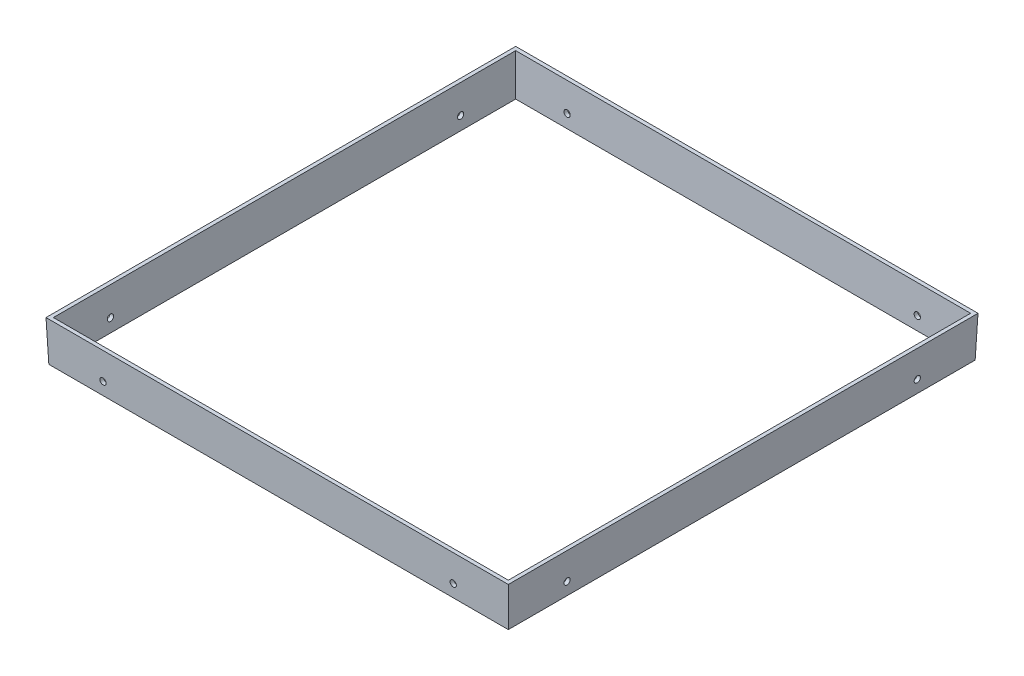
from build123d import *

# Parameters (mm, degrees)
SKETCH2_W           = 249.3
SKETCH2_H           = 253.3
BOSS_EXTRUDE1_DEPTH = 22
BOSS_EXTRUDE1_DRAFT = -2
SHELL1_T            = -2
SKETCH4_R           = 1.7
CUT_EXTRUDE1_DEPTH  = 292
SKETCH5_R           = 1.7
CUT_EXTRUDE2_DEPTH  = 292


with BuildPart() as part:
    # Sketch2 → Boss-Extrude1 (with draft: the straight prism first)
    with BuildSketch(Plane(origin=(0, 0, 0), x_dir=(1, 0, 0), z_dir=(0, 1, 0))):
        Rectangle(SKETCH2_W, SKETCH2_H)
    extrude(amount=BOSS_EXTRUDE1_DEPTH)
    # Boss-Extrude1: the draft: its side faces are tilted about the plane it starts from
    boss_extrude1_sides = [part.faces().sort_by_distance(p)[0] for p in [
        (0, 11, 126.65),
        (124.65, 11, 0),
        (0, 11, -126.65),
        (-124.65, 11, 0),
    ]]
    draft(boss_extrude1_sides, Plane(origin=(0, 0, 0), x_dir=(1, 0, 0), z_dir=(0, 1, 0)), BOSS_EXTRUDE1_DRAFT)

    # Shell1
    shell1_openings = [part.faces().sort_by_distance(p)[0] for p in [
        (0, 0, 0),
        (0, 22, 0),
    ]]
    offset(amount=SHELL1_T, openings=shell1_openings, kind=Kind.INTERSECTION)

    # Sketch4 → Cut-Extrude1 (cut, along a direction that is not the sketch's normal)
    with BuildSketch(Plane(origin=(124.498179432, -4.347572226, 0), x_dir=(0, 0, -1), z_dir=(0.9993908270190958, -0.03489949670250105, 0))):
        with Locations((-95, 11.2937907)):
            Circle(SKETCH4_R)
        with Locations((95, 11.2937907)):
            Circle(SKETCH4_R)
    extrude(amount=-CUT_EXTRUDE1_DEPTH, dir=(1, 0, 0), mode=Mode.SUBTRACT)

    # Sketch5 → Cut-Extrude2 (cut, along a direction that is not the sketch's normal)
    with BuildSketch(Plane(origin=(0, -4.4173287, -126.495743483), x_dir=(-1, 0, 0), z_dir=(0, -0.03489949670250106, -0.9993908270190958))):
        with Locations((-95, 11.363589693)):
            Circle(SKETCH5_R)
        with Locations((95, 11.363589693)):
            Circle(SKETCH5_R)
    extrude(amount=-CUT_EXTRUDE2_DEPTH, dir=(0, 0, -1), mode=Mode.SUBTRACT)


solid = part.part
